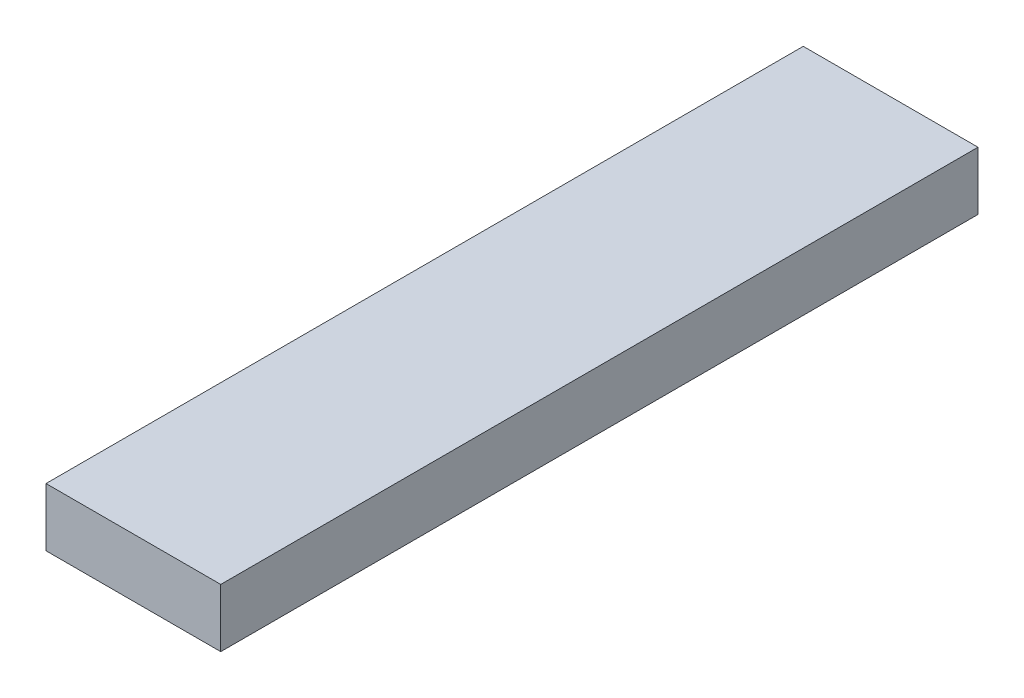
from build123d import *

# Parameters (mm, degrees)
SKETCH1_W           = 90
SKETCH1_H           = 30
BOSS_EXTRUDE1_DEPTH = 195


with BuildPart() as part:
    # Sketch1 → Boss-Extrude1 (new, symmetric)
    with BuildSketch(Plane.XY):
        Rectangle(SKETCH1_W, SKETCH1_H)
    extrude(amount=BOSS_EXTRUDE1_DEPTH, both=True)


solid = part.part
